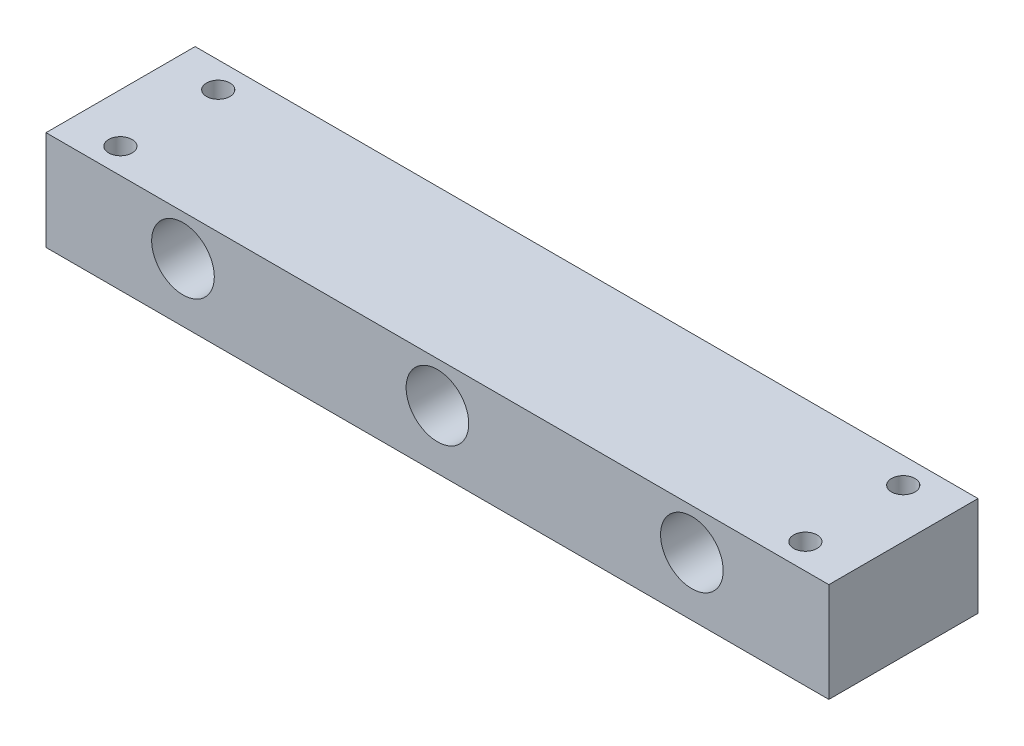
from build123d import *

# Parameters (mm, degrees)
SKETCH1_W           = 400
SKETCH1_H           = 76.2
BOSS_EXTRUDE1_DEPTH = 50.8
SKETCH3_R           = 6
CUT_EXTRUDE2_DEPTH  = 50.8
SKETCH5_R           = 16
CUT_EXTRUDE3_DEPTH  = 411.349948215


with BuildPart() as part:
    # Sketch1 → Boss-Extrude1 (new body)
    with BuildSketch(Plane(origin=(0, 0, 0), x_dir=(1, 0, 0), z_dir=(0, 1, 0))):
        with Locations((200, 38.1)):
            Rectangle(SKETCH1_W, SKETCH1_H)
    extrude(amount=BOSS_EXTRUDE1_DEPTH)

    # Sketch3 → Cut-Extrude2 (cut)
    with BuildSketch(Plane(origin=(0, 50.8, 0), x_dir=(1, 0, 0), z_dir=(0, 1, 0))):
        with Locations((25, 63)):
            Circle(SKETCH3_R)
        with Locations((25, 13)):
            Circle(SKETCH3_R)
        with Locations((375, 63)):
            Circle(SKETCH3_R)
        with Locations((375, 13)):
            Circle(SKETCH3_R)
    extrude(amount=-CUT_EXTRUDE2_DEPTH, mode=Mode.SUBTRACT)

    # Sketch5 → Cut-Extrude3 (cut, through all)
    with BuildSketch(Plane.XY):
        with Locations((200, 30)):
            Circle(SKETCH5_R)
        with Locations((330, 30)):
            Circle(SKETCH5_R)
        with Locations((70, 30)):
            Circle(SKETCH5_R)
    extrude(amount=-CUT_EXTRUDE3_DEPTH, mode=Mode.SUBTRACT)


solid = part.part
